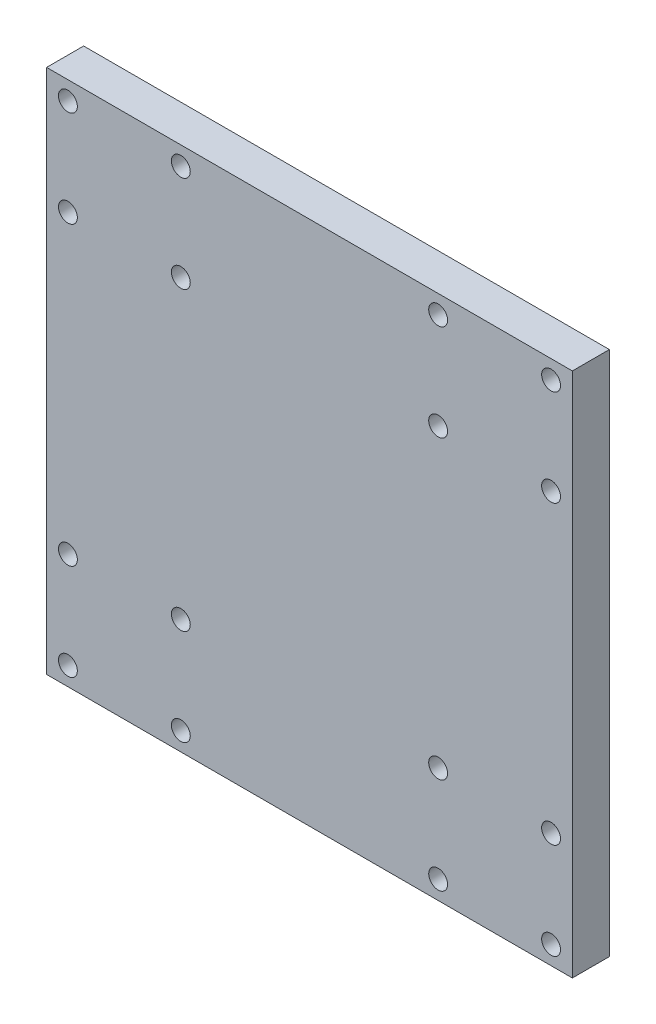
from build123d import *

# Parameters (mm, degrees)
SKETCH1_W           = 142
SKETCH1_H           = 142
BOSS_EXTRUDE1_DEPTH = 5
SKETCH2_R           = 2.55
CUT_EXTRUDE1_DEPTH  = 101.905896755


with BuildPart() as part:
    # Sketch1 → Boss-Extrude1 (new, symmetric)
    with BuildSketch(Plane.XY):
        Rectangle(SKETCH1_W, SKETCH1_H)
    extrude(amount=BOSS_EXTRUDE1_DEPTH, both=True)

    # Sketch2 → Cut-Extrude1 (cut, through all)
    with BuildSketch(Plane.XY.offset(5)):
        with Locations((-65.25, 66)):
            Circle(SKETCH2_R)
        with Locations((-34.75, 66)):
            Circle(SKETCH2_R)
        with Locations((-34.75, 40)):
            Circle(SKETCH2_R)
        with Locations((-65.25, 40)):
            Circle(SKETCH2_R)
        with Locations((65.25, 66)):
            Circle(SKETCH2_R)
        with Locations((65.25, 40)):
            Circle(SKETCH2_R)
        with Locations((34.75, 40)):
            Circle(SKETCH2_R)
        with Locations((34.75, 66)):
            Circle(SKETCH2_R)
        with Locations((-65.25, -40)):
            Circle(SKETCH2_R)
        with Locations((-34.75, -40)):
            Circle(SKETCH2_R)
        with Locations((-34.75, -66)):
            Circle(SKETCH2_R)
        with Locations((-65.25, -66)):
            Circle(SKETCH2_R)
        with Locations((34.75, -40)):
            Circle(SKETCH2_R)
        with Locations((65.25, -40)):
            Circle(SKETCH2_R)
        with Locations((65.25, -66)):
            Circle(SKETCH2_R)
        with Locations((34.75, -66)):
            Circle(SKETCH2_R)
    extrude(amount=-CUT_EXTRUDE1_DEPTH, mode=Mode.SUBTRACT)


solid = part.part
